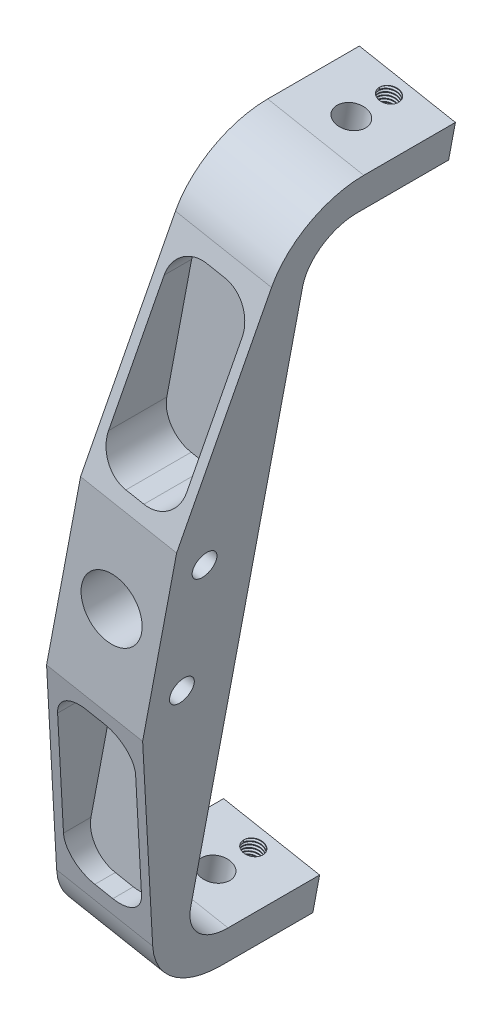
from build123d import *

# Parameters (mm, degrees)
SKETCH1_R               = 10
BOSS_EXTRUDE1_DEPTH     = 28.5
BOSS_EXTRUDE2_DEPTH     = 45
SKETCH4_R               = 4.7625
SKETCH4_R_2             = 3.175
CUT_EXTRUDE1_DEPTH      = 263.202892879
FILLET3_R               = 15
CUT_EXTRUDE2_DEPTH      = 147.466057605
CUT_EXTRUDE2_DEPTH_BACK = 147.466057605
SKETCH10_R              = 4
CUT_EXTRUDE4_DEPTH      = 22.5
THREAD1_PITCH           = 1.058333333
THREAD2_PITCH           = 1.058333333


with BuildPart() as part:
    # Sketch1 → Boss-Extrude1 (new body)
    with BuildSketch(Plane.XY):
        Polygon((-7.617068705, -126.66669812), (39.062241625, 120.733646626), (7.617068705, 126.66669812), (-39.062241625, -120.733646626), align=None)
        with Locations(Location((0, 0, 0), (0, 0, 180))):
            Circle(SKETCH1_R, mode=Mode.SUBTRACT)
    extrude(amount=BOSS_EXTRUDE1_DEPTH)

    # Sketch2 → Boss-Extrude2 (add)
    with BuildSketch(Plane(origin=(0, 0, 0), x_dir=(-1, 0, 0), z_dir=(0, 0, -1))):
        Polygon((-39.062241625, 120.733646626), (-36.837347314, 108.941706781), (-5.392174394, 114.874758275), (-7.617068705, 126.66669812), align=None)
        Polygon((36.837347314, -108.941706781), (5.392174394, -114.874758275), (7.617068705, -126.66669812), (39.062241625, -120.733646626), align=None)
    extrude(amount=BOSS_EXTRUDE2_DEPTH)

    # Sketch4 → Cut-Extrude1 (cut, through all)
    with BuildSketch(Plane(origin=(-1.656161502, 128.416364197, 0), x_dir=(0.982661653748471, -0.18540785919782457, 0), z_dir=(0.18540785919782457, 0.982661653748471, 0))):
        with Locations(Location((25.436849572, 26.64759704, 0), (0, 0, 180))):
            Circle(SKETCH4_R)
        with Locations(Location((25.436849572, 39, 0), (0, 0, 180))):
            Circle(SKETCH4_R_2)
    extrude(amount=-CUT_EXTRUDE1_DEPTH, mode=Mode.SUBTRACT)

    # Fillet3
    fillet3_edges = [part.edges().sort_by_distance(p)[0] for p in [
        (21.114760854, 111.908232528, 0),
        (-21.114760854, -111.908232528, 0),
    ]]
    fillet(fillet3_edges, radius=FILLET3_R)

    # Sketch10 → Cut-Extrude2 (cut, two sides: drawn at the far end of the back side and taken through both)
    with BuildSketch(Plane(origin=(-16.024269994, 1.367603019, 0), x_dir=(0, 0, -1), z_dir=(0.9826616537484708, -0.18540785919782463, 0)).offset(-CUT_EXTRUDE2_DEPTH_BACK)):
        with Locations(Location((-17.5, 21.627134551, 0), (0, 0, 90))):
            Circle(SKETCH10_R)
        with Locations(Location((-17.5, -18.372865449, 0), (0, 0, 90))):
            Circle(SKETCH10_R)
        with BuildLine():
            Line((-28.5, 31.627134551), (-11.316666773, 106.545885621))
            ThreePointArc((-11.316666773, 106.545885621), (-1.82302812, 121.628280107), (15, 127.509906002))
            Line((15, 127.509906002), (-44.768549469, 140.171550448))
            Line((-44.768549469, 140.171550448), (-46.912682998, 31.416920937))
            Line((-46.912682998, 31.416920937), (-28.5, 31.627134551))
        make_face()
        with BuildLine():
            Line((-44.768549469, -136.917281346), (15, -124.255636901))
            ThreePointArc((15, -124.255636901), (-1.82302812, -118.374011006), (-11.316666773, -103.29161652))
            Line((-11.316666773, -103.29161652), (-28.5, -28.372865449))
            Line((-28.5, -28.372865449), (-46.912682998, -28.162651835))
            Line((-46.912682998, -28.162651835), (-44.768549469, -136.917281346))
        make_face()
    extrude(amount=CUT_EXTRUDE2_DEPTH + CUT_EXTRUDE2_DEPTH_BACK, mode=Mode.SUBTRACT)

    # Sketch11 → Cut-Extrude4 (cut)
    with BuildSketch(Plane.XY.offset(28.5)):
        with BuildLine():
            Line((3.541290111, 34.949381459), (9.437260033, 33.836934304))
            ThreePointArc((9.437260033, 33.836934304), (16.92877427, 35.404052106), (21.117955163, 41.809472249))
            Line((21.117955163, 41.809472249), (29.254165873, 84.931389014))
            ThreePointArc((29.254165873, 84.931389014), (27.687048071, 92.422903251), (21.281627928, 96.612084144))
            Line((21.281627928, 96.612084144), (15.385658005, 97.724531299))
            ThreePointArc((15.385658005, 97.724531299), (7.894143769, 96.157413497), (3.704962876, 89.751993354))
            Line((3.704962876, 89.751993354), (-4.431247835, 46.630076588))
            ThreePointArc((-4.431247835, 46.630076588), (-2.864130032, 39.138562352), (3.541290111, 34.949381459))
        make_face()
        with BuildLine():
            Line((-21.281627928, -96.612084144), (-15.385658005, -97.724531299))
            ThreePointArc((-15.385658005, -97.724531299), (-7.894143769, -96.157413497), (-3.704962876, -89.751993354))
            Line((-3.704962876, -89.751993354), (4.431247835, -46.630076588))
            ThreePointArc((4.431247835, -46.630076588), (2.864130032, -39.138562352), (-3.541290111, -34.949381459))
            Line((-3.541290111, -34.949381459), (-9.437260033, -33.836934304))
            ThreePointArc((-9.437260033, -33.836934304), (-16.92877427, -35.404052106), (-21.117955163, -41.809472249))
            Line((-21.117955163, -41.809472249), (-29.254165873, -84.931389014))
            ThreePointArc((-29.254165873, -84.931389014), (-27.687048071, -92.422903251), (-21.281627928, -96.612084144))
        make_face()
    extrude(amount=-CUT_EXTRUDE4_DEPTH, mode=Mode.SUBTRACT)

    # Thread1: the profile of Thread Profile2 profile screwed along a right-hand helix of 9.448819 turns, 8 arcs to a turn; built about Z, then put on its axis
    thread1_z = Axis((0, 0, 0), (0, 0, 1))
    thread1_corners = [(3.1747, 0, -0.000173206), (3.747839718, 0, 0.330729165), (3.747839718, 0, 0.463020831), (3.1747, 0, 0.793923202)]
    with BuildLine(mode=Mode.PRIVATE) as thread1_profile:
        Line(thread1_corners[0], thread1_corners[1])
        Line(thread1_corners[1], thread1_corners[2])
        Line(thread1_corners[2], thread1_corners[3])
        Line(thread1_corners[3], thread1_corners[0])
    thread1_cap = Face(thread1_profile.wire())
    thread1_turn_angles = [0, 22.5, 45, 67.5, 90, 112.5, 135, 157.5, 180, 202.5, 225, 247.5, 270, 292.5, 315, 337.5, 360]
    thread1_turn_weights = [1, 0.9238795325112867, 1, 0.9238795325112867, 1, 0.9238795325112867, 1, 0.9238795325112867, 1, 0.9238795325112867, 1, 0.9238795325112867, 1, 0.9238795325112867, 1, 0.9238795325112867, 1]
    thread1_turn_rails = [Edge.make_bspline([Vector(p[0], p[1], 0).rotate(thread1_z, thread1_turn_angles[k]) / thread1_turn_weights[k] + Vector(0, 0, p[2] + THREAD1_PITCH * thread1_turn_angles[k] / 360) for k in range(17)], [0, 0, 0, 1, 1, 2, 2, 3, 3, 4, 4, 5, 5, 6, 6, 7, 7, 8, 8, 8], 2, thread1_turn_weights) for p in thread1_corners]
    thread1_turn_sides = [Face.make_surface_from_curves(thread1_turn_rails[p[0]], thread1_turn_rails[p[1]]) for p in [(0, 1), (1, 2), (2, 3), (3, 0)]]
    thread1_last_angles = [3240, 3262.5, 3285, 3307.5, 3330, 3352.5, 3375, 3388.287401575, 3401.57480315]
    thread1_last_weights = [1, 0.9238795325112867, 1, 0.9238795325112867, 1, 0.9238795325112867, 1, 0.9732294335070504, 1]
    thread1_last_rails = [Edge.make_bspline([Vector(p[0], p[1], 0).rotate(thread1_z, thread1_last_angles[k]) / thread1_last_weights[k] + Vector(0, 0, p[2] + THREAD1_PITCH * thread1_last_angles[k] / 360) for k in range(9)], [0, 0, 0, 1, 1, 2, 2, 3, 3, 4, 4, 4], 2, thread1_last_weights) for p in thread1_corners]
    thread1_last_sides = [Face.make_surface_from_curves(thread1_last_rails[p[0]], thread1_last_rails[p[1]]) for p in [(0, 1), (1, 2), (2, 3), (3, 0)]]
    thread1 = Plane(origin=(23.339655165, 123.700172373, -39), x_dir=(-0.982661654, 0.185407859, 0), z_dir=(-0.185407859, -0.982661654, 0)) * Solid(Shell([*[p.moved(Location((0, 0, THREAD1_PITCH * i))) for i in range(9) for p in thread1_turn_sides], *thread1_last_sides, thread1_cap, thread1_cap.rotate(thread1_z, 3401.57480315).moved(Location((0, 0, THREAD1_PITCH * 3401.57480315 / 360)))]))
    add(thread1, mode=Mode.SUBTRACT)

    # Thread2: the profile of Thread Profile3 profile screwed along a right-hand helix of 11.338583 turns, 8 arcs to a turn; built about Z, then put on its axis
    thread2_z = Axis((0, 0, 0), (0, 0, 1))
    thread2_corners = [(3.1747, 0, -0.000173206), (3.747839718, 0, 0.330729164), (3.747839718, 0, 0.463020831), (3.174700001, 0, 0.793923201)]
    with BuildLine(mode=Mode.PRIVATE) as thread2_profile:
        Line(thread2_corners[0], thread2_corners[1])
        Line(thread2_corners[1], thread2_corners[2])
        Line(thread2_corners[2], thread2_corners[3])
        Line(thread2_corners[3], thread2_corners[0])
    thread2_cap = Face(thread2_profile.wire())
    thread2_turn_angles = [0, 22.5, 45, 67.5, 90, 112.5, 135, 157.5, 180, 202.5, 225, 247.5, 270, 292.5, 315, 337.5, 360]
    thread2_turn_weights = [1, 0.9238795325112867, 1, 0.9238795325112867, 1, 0.9238795325112867, 1, 0.9238795325112867, 1, 0.9238795325112867, 1, 0.9238795325112867, 1, 0.9238795325112867, 1, 0.9238795325112867, 1]
    thread2_turn_rails = [Edge.make_bspline([Vector(p[0], p[1], 0).rotate(thread2_z, thread2_turn_angles[k]) / thread2_turn_weights[k] + Vector(0, 0, p[2] + THREAD2_PITCH * thread2_turn_angles[k] / 360) for k in range(17)], [0, 0, 0, 1, 1, 2, 2, 3, 3, 4, 4, 5, 5, 6, 6, 7, 7, 8, 8, 8], 2, thread2_turn_weights) for p in thread2_corners]
    thread2_turn_sides = [Face.make_surface_from_curves(thread2_turn_rails[p[0]], thread2_turn_rails[p[1]]) for p in [(0, 1), (1, 2), (2, 3), (3, 0)]]
    thread2_last_angles = [3960, 3982.5, 4005, 4027.5, 4050, 4065.94488189, 4081.88976378]
    thread2_last_weights = [1, 0.9238795325112867, 1, 0.9238795325112867, 1, 0.96152641217675, 1]
    thread2_last_rails = [Edge.make_bspline([Vector(p[0], p[1], 0).rotate(thread2_z, thread2_last_angles[k]) / thread2_last_weights[k] + Vector(0, 0, p[2] + THREAD2_PITCH * thread2_last_angles[k] / 360) for k in range(7)], [0, 0, 0, 1, 1, 2, 2, 3, 3, 3], 2, thread2_last_weights) for p in thread2_corners]
    thread2_last_sides = [Face.make_surface_from_curves(thread2_last_rails[p[0]], thread2_last_rails[p[1]]) for p in [(0, 1), (1, 2), (2, 3), (3, 0)]]
    thread2 = Plane(origin=(-21.114760854, -111.908232528, -39), x_dir=(-0.982661654, 0.185407859, 0), z_dir=(-0.185407859, -0.982661654, 0)) * Solid(Shell([*[p.moved(Location((0, 0, THREAD2_PITCH * i))) for i in range(11) for p in thread2_turn_sides], *thread2_last_sides, thread2_cap, thread2_cap.rotate(thread2_z, 4081.88976378).moved(Location((0, 0, THREAD2_PITCH * 4081.88976378 / 360)))]))
    add(thread2, mode=Mode.SUBTRACT)


solid = part.part
